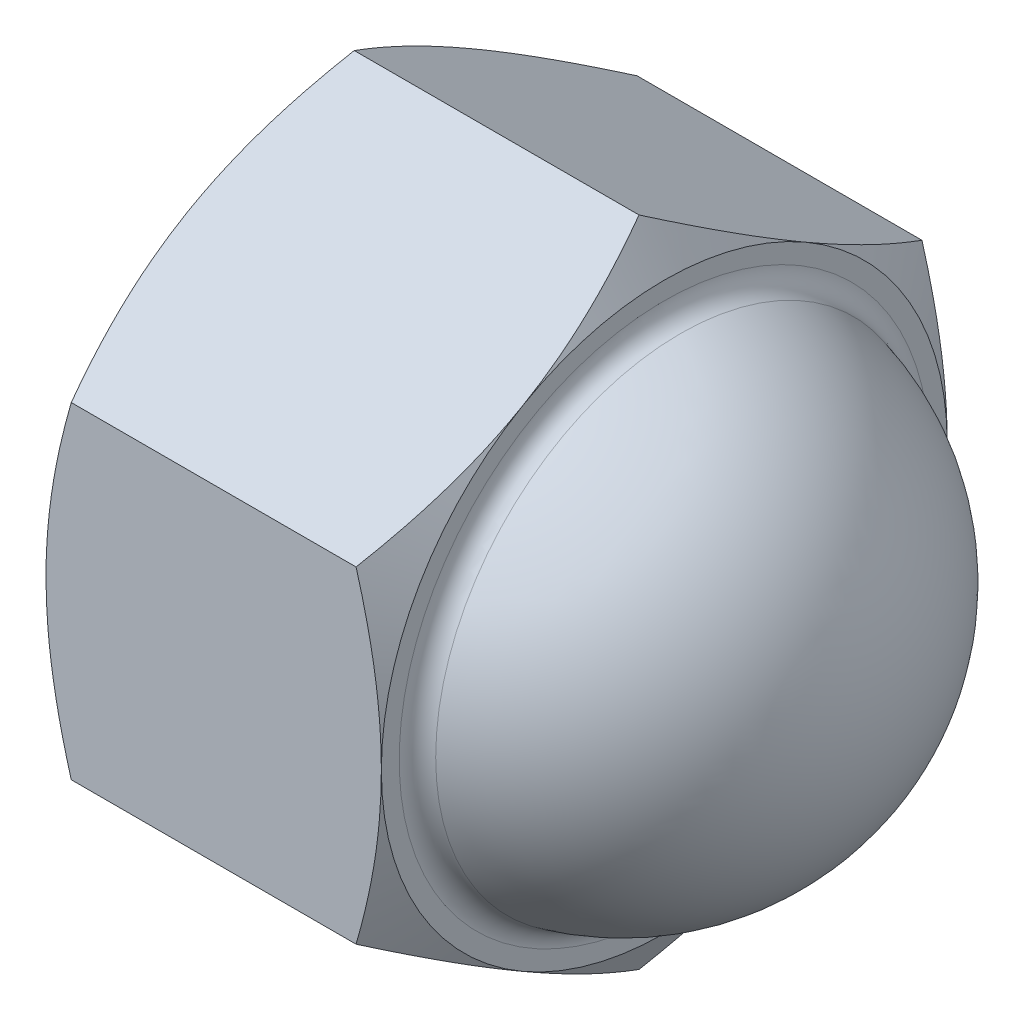
from build123d import *

# Parameters (mm, degrees)
BASENUT_DEPTH = 16
DOMEFILLET_R  = 1


with BuildPart() as part:
    # BaseNutSke → BaseNut (new body)
    with BuildSketch(Plane(origin=(0, 0, 0), x_dir=(0, 0, -1), z_dir=(1, 0, 0))):
        Polygon((13.5, 7.794228634), (13.5, -7.794228634), (0, -15.588457268), (-13.5, -7.794228634), (-13.5, 7.794228634), (0, 15.588457268), align=None)
    extrude(amount=BASENUT_DEPTH)

    # DomeSke → Dome (revolve)
    with BuildSketch(Plane.XY):
        with BuildLine():
            Line((26, 0), (24.4, 0))
            ThreePointArc((24.4, 0), (21.353910524, 7.353910524), (14, 10.4))
            Line((14, 10.4), (0, 10.4))
            Line((0, 10.4), (0, 12))
            Line((0, 12), (14, 12))
            ThreePointArc((14, 12), (22.485281374, 8.485281374), (26, 0))
        make_face()
    revolve(axis=Axis((0, 0, 0), (1, 0, 0)))

    # Sketch4 → DoubleChamfer (revolve, cut)
    with BuildSketch(Plane.XY):
        Polygon((0, 13.5), (2.504809472, 17.838457268), (13.495190528, 17.838457268), (16, 13.5), (18, 13.5), (18, 28.5), (-2, 28.5), (-2, 13.5), align=None)
    revolve(axis=Axis((0, 0, 0), (1, 0, 0)), mode=Mode.SUBTRACT)

    # TapDriSke → TapDrill (revolve, cut)
    with BuildSketch(Plane.XY):
        Polygon((0, 8.75), (18.4, 8.75), (23.657530416, 0), (0, 0), align=None)
    revolve(axis=Axis((0, 0, 0), (1, 0, 0)), mode=Mode.SUBTRACT)

    # EndChamferSketch → EndChamfer (revolve, cut)
    with BuildSketch(Plane.XY):
        Polygon((-0.0746, 10), (0.0254, 10), (0.988185365, 8.625), (-0.0746, 8.625), align=None)
        Polygon((15.9746, 10), (16.1, 10), (16.1, 8.625), (15.011814635, 8.625), align=None)
    revolve(axis=Axis((0, 0, 0), (-1, 0, 0)), mode=Mode.SUBTRACT)

    # DomeFillet
    domefillet_edges = [part.edges().sort_by_distance(p)[0] for p in [
        (16, -11.832159566, 0),
    ]]
    fillet(domefillet_edges, radius=DOMEFILLET_R)


solid = part.part
